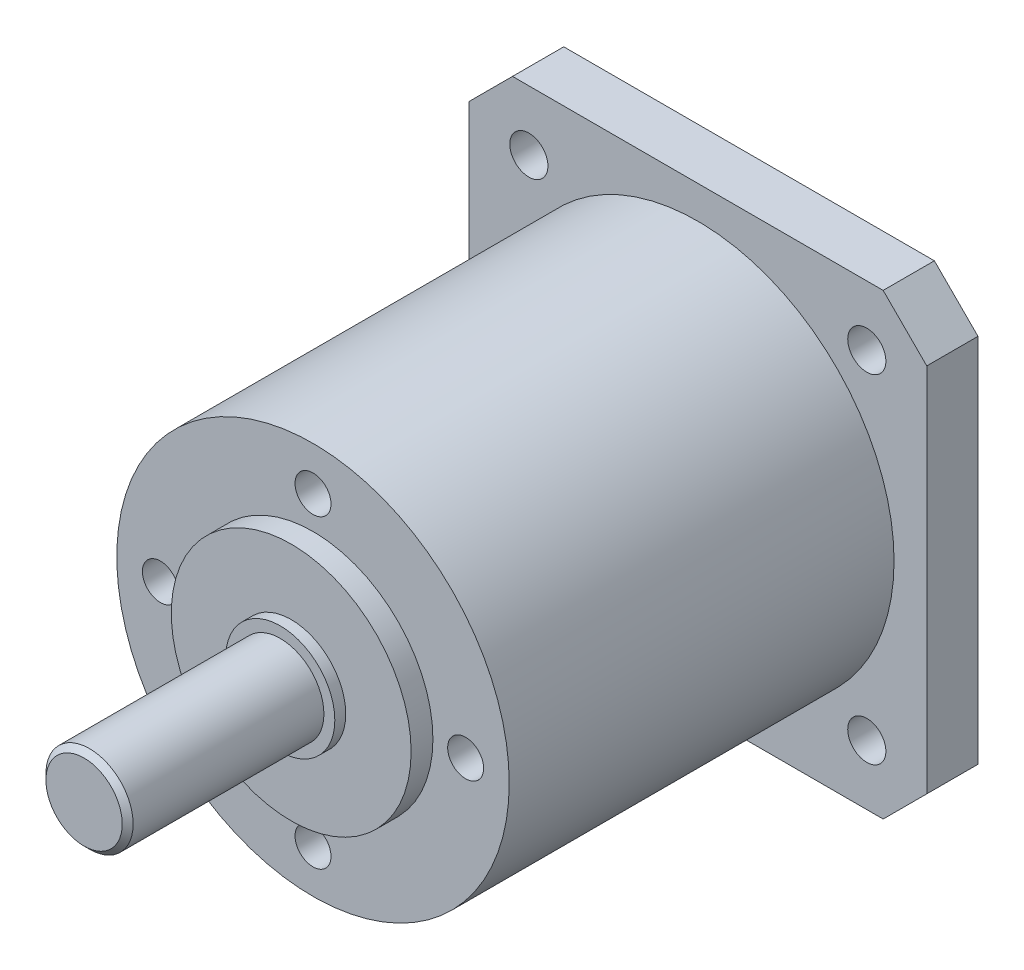
from build123d import *

# Parameters (mm, degrees)
BOSS_EXTRUDE1_DEPTH                = 4.7
SKETCH2_R                          = 18
BOSS_EXTRUDE2_DEPTH                = 35.3
F_3_5_3_5_DIAMETER_HOLE1_OUTLINE_R = 1.75
F_3_5_3_5_DIAMETER_HOLE1_DEPTH     = 4.7
SKETCH9_R                          = 11
BOSS_EXTRUDE3_DEPTH                = 2
SKETCH10_R                         = 5
BOSS_EXTRUDE4_DEPTH                = 1
SKETCH11_R                         = 4
BOSS_EXTRUDE5_DEPTH                = 18
CHAMFER1_SIZE                      = 0.5


# Read off the part's stored shape, not the designer's step: Ø3.5 (3.5) Diameter Hole1, Tap Drill for M4x0.7 Tap1
with BuildPart() as part:
    # Sketch1 → Boss-Extrude1 (new body)
    with BuildSketch(Plane.XY):
        Polygon((-21, 17), (-17, 21), (17, 21), (21, 17), (21, -17), (17, -21), (-17, -21), (-21, -17), align=None)
    extrude(amount=BOSS_EXTRUDE1_DEPTH)

    # Sketch2 → Boss-Extrude2 (add)
    with BuildSketch(Plane.XY.offset(4.7)):
        Circle(SKETCH2_R)
    extrude(amount=BOSS_EXTRUDE2_DEPTH)

    # Ø3.5 (3.5) Diameter Hole1 outline → Ø3.5 (3.5) Diameter Hole1 (cut)
    with BuildSketch(Plane.XY):
        with Locations((-15.5, 15.5)):
            Circle(F_3_5_3_5_DIAMETER_HOLE1_OUTLINE_R)
        with Locations((15.5, -15.5)):
            Circle(F_3_5_3_5_DIAMETER_HOLE1_OUTLINE_R)
        with Locations((15.5, 15.5)):
            Circle(F_3_5_3_5_DIAMETER_HOLE1_OUTLINE_R)
        with Locations((-15.5, -15.5)):
            Circle(F_3_5_3_5_DIAMETER_HOLE1_OUTLINE_R)
    extrude(amount=F_3_5_3_5_DIAMETER_HOLE1_DEPTH, mode=Mode.SUBTRACT)

    # Tap Drill for M4x0.7 Tap1 outline → Tap Drill for M4x0.7 Tap1 (revolve, cut)
    with BuildSketch(Plane(origin=(14, 0, 0), x_dir=(1, 0, 0), z_dir=(0, -1, 0))):
        Polygon((0, 40), (0, 31.008579979), (1.65, 32), (1.65, 40), align=None)
    revolve(axis=Axis((14, 0, 0), (0, 0, 1)), mode=Mode.SUBTRACT)

    # Tap Drill for M4x0.7 Tap1 2 outline → Tap Drill for M4x0.7 Tap1 2 (revolve, cut)
    with BuildSketch(Plane(origin=(-14, 0, 0), x_dir=(1, 0, 0), z_dir=(0, -1, 0))):
        Polygon((0, 40), (0, 31.008579979), (1.65, 32), (1.65, 40), align=None)
    revolve(axis=Axis((-14, 0, 0), (0, 0, 1)), mode=Mode.SUBTRACT)

    # Tap Drill for M4x0.7 Tap1 3 outline → Tap Drill for M4x0.7 Tap1 3 (revolve, cut)
    with BuildSketch(Plane.XZ.offset(14)):
        Polygon((0, 40), (0, 31.008579979), (1.65, 32), (1.65, 40), align=None)
    revolve(axis=Axis((0, -14, 0), (0, 0, 1)), mode=Mode.SUBTRACT)

    # Tap Drill for M4x0.7 Tap1 4 outline → Tap Drill for M4x0.7 Tap1 4 (revolve, cut)
    with BuildSketch(Plane.XZ.offset(-14)):
        Polygon((0, 40), (0, 31.008579979), (1.65, 32), (1.65, 40), align=None)
    revolve(axis=Axis((0, 14, 0), (0, 0, 1)), mode=Mode.SUBTRACT)

    # Sketch9 → Boss-Extrude3 (add)
    with BuildSketch(Plane.XY.offset(40)):
        Circle(SKETCH9_R)
    extrude(amount=BOSS_EXTRUDE3_DEPTH)

    # Sketch10 → Boss-Extrude4 (add)
    with BuildSketch(Plane.XY.offset(42)):
        Circle(SKETCH10_R)
    extrude(amount=BOSS_EXTRUDE4_DEPTH)

    # Sketch11 → Boss-Extrude5 (add)
    with BuildSketch(Plane.XY.offset(43)):
        Circle(SKETCH11_R)
    extrude(amount=BOSS_EXTRUDE5_DEPTH)

    # Chamfer1
    chamfer1_edges = [part.edges().sort_by_distance(p)[0] for p in [
        (-4, 0, 61),
    ]]
    chamfer(chamfer1_edges, length=CHAMFER1_SIZE)


solid = part.part
